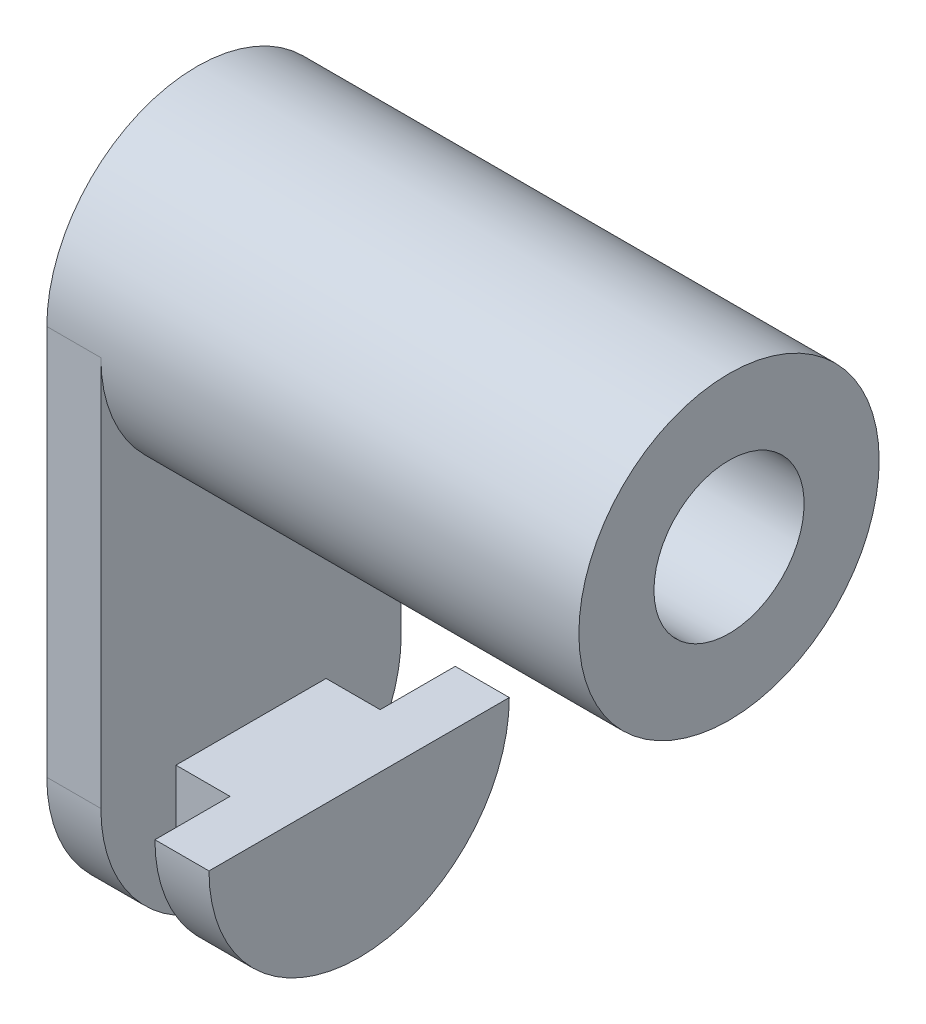
from build123d import *

# Parameters (mm, degrees)
SKETCH1_R                = 6.35
SKETCH1_R_2              = 3.175
BOSS_EXTRUDE1_DEPTH      = 22.5
SKETCH1_3_R              = 3.175
SKETCH1_3_R_2            = 3
BOSS_EXTRUDE2_DEPTH      = 7
BOSS_EXTRUDE3_DEPTH      = 6.35
BOSS_EXTRUDE3_DEPTH_BACK = 6.35
SKETCH3_W                = 6.35
SKETCH3_H                = 2.286
BOSS_EXTRUDE4_DEPTH      = 3.175
BOSS_EXTRUDE4_DEPTH_BACK = 3.175
SKETCH3_4_W              = 6.35
SKETCH3_4_H              = 2.286
SKETCH1_4_R              = 3
CUT_EXTRUDE2_DEPTH       = 33.697891369
FILLET1_R                = 6.35


with BuildPart() as part:
    # Sketch1 → Boss-Extrude1 (new body)
    with BuildSketch(Plane.YZ):
        with Locations(Location((0, 0, 0), (0, 0, 90))):
            Circle(SKETCH1_R)
        with Locations(Location((0, 0, 0), (0, 0, 90))):
            Circle(SKETCH1_R_2, mode=Mode.SUBTRACT)
    extrude(amount=BOSS_EXTRUDE1_DEPTH)

    # Sketch1<3> → Boss-Extrude2 (add)
    with BuildSketch(Plane.YZ):
        with Locations(Location((0, 0, 0), (0, 0, 90))):
            Circle(SKETCH1_3_R)
        with Locations(Location((0, 0, 0), (0, 0, 270))):
            Circle(SKETCH1_3_R_2, mode=Mode.SUBTRACT)
    extrude(amount=BOSS_EXTRUDE2_DEPTH)

    # Sketch3 → Boss-Extrude3 (add, two sides: drawn at the far end of the back side and taken through both)
    with BuildSketch(Plane(origin=(0, 0, 0), x_dir=(0, 1, 0), z_dir=(0, 0, 1)).offset(-BOSS_EXTRUDE3_DEPTH_BACK)):
        Polygon((0, -2.286), (0, 0), (-22.86, 0), (-22.86, -2.286), (-16.51, -2.286), align=None)
        with Locations((-19.685, -5.715)):
            Rectangle(SKETCH3_W, SKETCH3_H)
    extrude(amount=BOSS_EXTRUDE3_DEPTH + BOSS_EXTRUDE3_DEPTH_BACK)


with BuildPart() as boss_extrude3_piece_1:
    # of the separate pieces the step leaves, piece 1, a body of its own (boss_extrude3_pieces)
    add(part.part.solids().sort_by_distance((0, 0, -6.35))[0])



with BuildPart() as boss_extrude3_piece_2:
    # of the separate pieces the step leaves, piece 2, a body of its own (boss_extrude3_pieces)
    add(part.part.solids().sort_by_distance((4.572, -16.51, 6.35))[0])


with BuildPart() as boss_extrude3_piece_1_1:
    add(boss_extrude3_piece_1.part)

    add(boss_extrude3_piece_2.part)  # Boss-Extrude4 merges Boss-Extrude3 piece 2
    # Sketch3<4> → Boss-Extrude4 (add, two sides: drawn at the far end of the back side and taken through both)
    with BuildSketch(Plane(origin=(0, 0, 0), x_dir=(0, 1, 0), z_dir=(0, 0, 1)).offset(-BOSS_EXTRUDE4_DEPTH_BACK)):
        with Locations((-19.685, -3.429)):
            Rectangle(SKETCH3_4_W, SKETCH3_4_H)
    extrude(amount=BOSS_EXTRUDE4_DEPTH + BOSS_EXTRUDE4_DEPTH_BACK)

    # Sketch1<4> → Cut-Extrude2 (cut, through all)
    with BuildSketch(Plane.YZ):
        with Locations(Location((0, 0, 0), (0, 0, 270))):
            Circle(SKETCH1_4_R)
    extrude(amount=CUT_EXTRUDE2_DEPTH, mode=Mode.SUBTRACT)

    # Fillet1
    # the kernel refuses this fillet: 6.35 mm, written as the material it takes off along each edge
    with BuildSketch(Plane(origin=(-15.875, -22.86, -6.35), x_dir=(0, 1, 0), z_dir=(1, 0, 0))) as fillet1_piece_1:
        with BuildLine():
            CenterArc((FILLET1_R, FILLET1_R), FILLET1_R, 180, 90)
            Line((0, FILLET1_R), (0, 0))
            Line((0, 0), (FILLET1_R, 0))
        make_face()
    extrude(amount=34.036, mode=Mode.SUBTRACT)
    with BuildSketch(Plane(origin=(-15.875, -22.86, 6.35), x_dir=(0, 1, 0), z_dir=(1, 0, 0))) as fillet1_piece_2:
        with BuildLine():
            CenterArc((FILLET1_R, -FILLET1_R), FILLET1_R, 90, 90)
            Line((0, -FILLET1_R), (0, 0))
            Line((0, 0), (FILLET1_R, 0))
        make_face()
    extrude(amount=34.036, mode=Mode.SUBTRACT)


solid = boss_extrude3_piece_1_1.part
